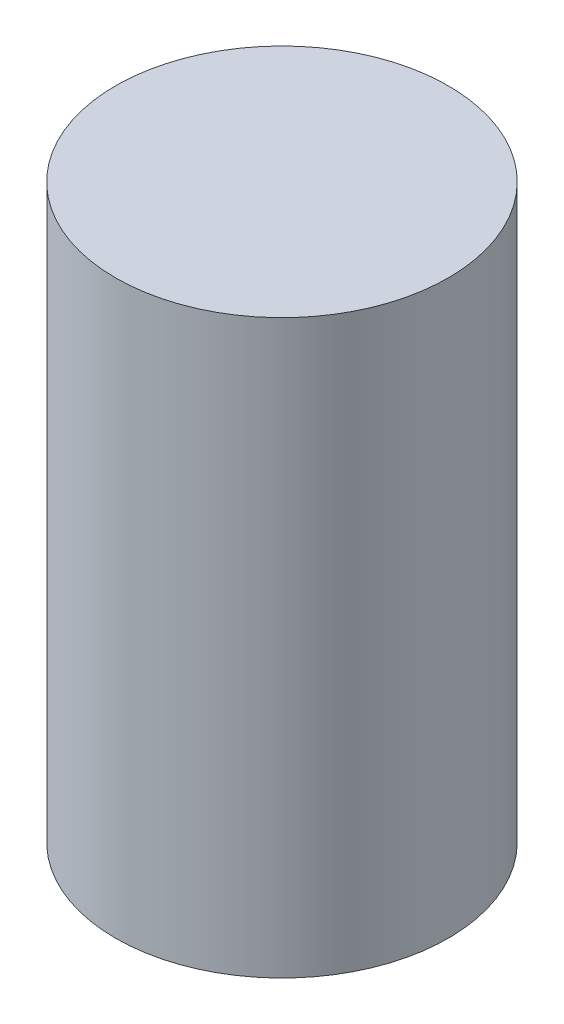
from build123d import *

# Parameters (mm, degrees)
SKETCH1_R           = 4
BOSS_EXTRUDE1_DEPTH = 13.75


with BuildPart() as part:
    # Sketch1 → Boss-Extrude1 (new body)
    with BuildSketch(Plane(origin=(0, 0, 0), x_dir=(1, 0, 0), z_dir=(0, 1, 0))):
        Circle(SKETCH1_R)
    extrude(amount=BOSS_EXTRUDE1_DEPTH)


solid = part.part
